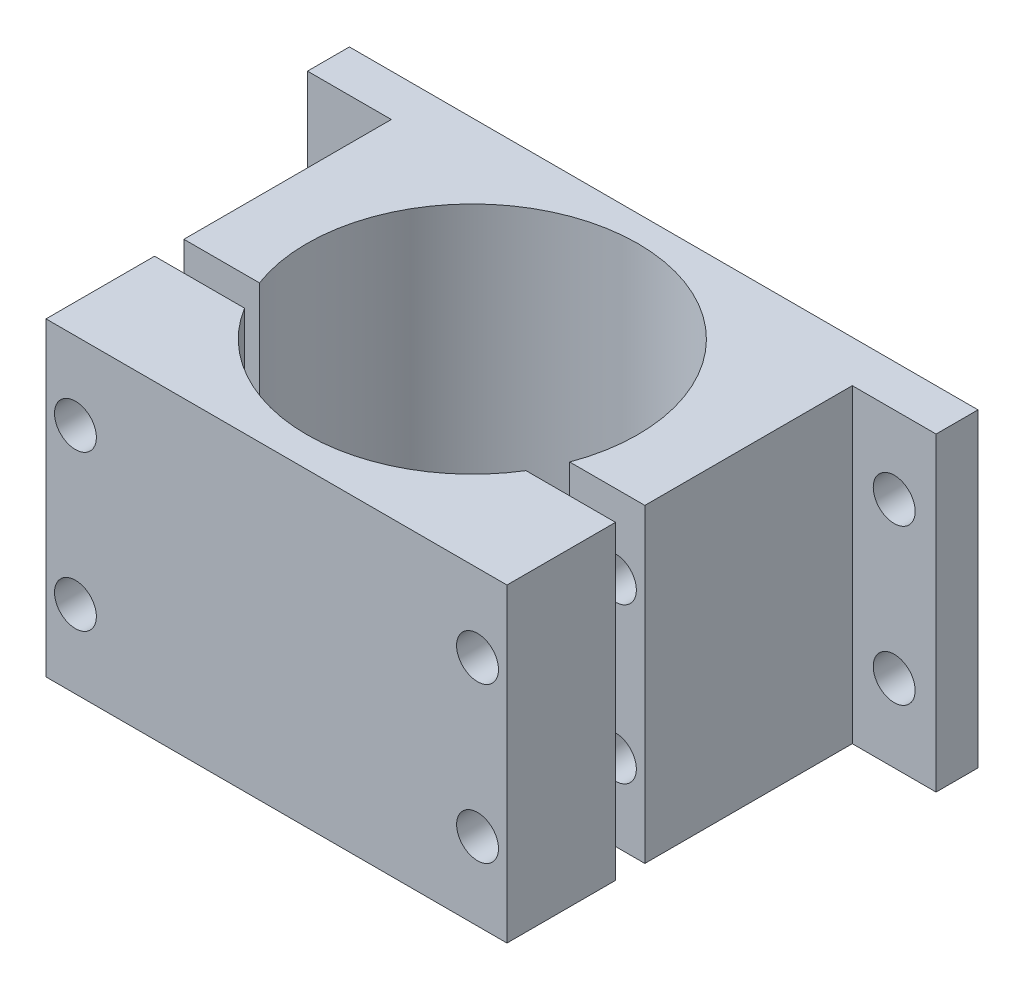
from build123d import *

# Parameters (mm, degrees)
SKETCH1_W              = 75
SKETCH1_H              = 37
BOSS_EXTRUDE1_DEPTH    = 5
SKETCH19_W             = 55
SKETCH19_H             = 37
BOSS_EXTRUDE5_DEPTH    = 41.2
SKETCH20_R             = 19.75
CUT_EXTRUDE7_DEPTH     = 71.069180101
SKETCH22_R             = 2.498129319
CUT_EXTRUDE8_DEPTH     = 25
SPLIT1_SURFACE_1_BACK  = 96.543
SPLIT1_SURFACE_1_DEPTH = 193.086
SPLIT1_SURFACE_2_BACK  = 96.543
SPLIT1_SURFACE_2_DEPTH = 193.086
SKETCH23_R             = 2.5
CUT_EXTRUDE9_DEPTH     = 59.702129433
SKETCH24_W             = 55
SKETCH24_H             = 3.5
CUT_EXTRUDE10_DEPTH    = 71.069180101


with BuildPart() as part:
    # Sketch1 → Boss-Extrude1 (new body)
    with BuildSketch(Plane.XY):
        Rectangle(SKETCH1_W, SKETCH1_H)
    extrude(amount=BOSS_EXTRUDE1_DEPTH)

    # Sketch19 → Boss-Extrude5 (add)
    with BuildSketch(Plane.XY.offset(5)):
        Rectangle(SKETCH19_W, SKETCH19_H)
    extrude(amount=BOSS_EXTRUDE5_DEPTH)

    # Sketch20 → Cut-Extrude7 (cut, through all)
    with BuildSketch(Plane(origin=(0, 18.5, 0), x_dir=(1, 0, 0), z_dir=(0, 1, 0))):
        with Locations((0.023568345, -22.855008575)):
            Circle(SKETCH20_R)
    extrude(amount=-CUT_EXTRUDE7_DEPTH, mode=Mode.SUBTRACT)

    # Sketch22 → Cut-Extrude8 (cut)
    with BuildSketch(Plane.XY.offset(46.2)):
        with Locations((-23.988215828, 9.25)):
            Circle(SKETCH22_R)
        with Locations((-23.988215828, -9.25)):
            Circle(SKETCH22_R)
        with Locations((23.988215828, -9.25)):
            Circle(SKETCH22_R)
        with Locations((23.988215828, 9.25)):
            Circle(SKETCH22_R)
    extrude(amount=-CUT_EXTRUDE8_DEPTH, mode=Mode.SUBTRACT)


with BuildPart() as body_2:
    # Split1: the piece behind the surface
    add(part.part)
    # Split1 surface: a surface, the sketch's curves swept straight by 193.086 mm
    with BuildLine(Plane(origin=(0, 18.5, 0), x_dir=(1, 0, 0), z_dir=(0, 1, 0)).offset(-SPLIT1_SURFACE_1_BACK), mode=Mode.PRIVATE) as split1_surface_1_path:
        Line((-27.5, -33.248134685), (27.5, -33.248134685))
    split1_surface_1 = Shell.extrude(split1_surface_1_path.wire(), (0 * SPLIT1_SURFACE_1_DEPTH, 1 * SPLIT1_SURFACE_1_DEPTH, 0 * SPLIT1_SURFACE_1_DEPTH))
    split(bisect_by=split1_surface_1, keep=Keep.BOTTOM)


with BuildPart() as part_1:
    add(part.part)

    # Split1: split by a surface, the side it looks to stays
    # Split1 surface: a surface, the sketch's curves swept straight by 193.086 mm
    with BuildLine(Plane(origin=(0, 18.5, 0), x_dir=(1, 0, 0), z_dir=(0, 1, 0)).offset(-SPLIT1_SURFACE_2_BACK), mode=Mode.PRIVATE) as split1_surface_2_path:
        Line((-27.5, -33.248134685), (27.5, -33.248134685))
    split1_surface_2 = Shell.extrude(split1_surface_2_path.wire(), (0 * SPLIT1_SURFACE_2_DEPTH, 1 * SPLIT1_SURFACE_2_DEPTH, 0 * SPLIT1_SURFACE_2_DEPTH))
    split(bisect_by=split1_surface_2, keep=Keep.TOP)

    # Sketch23 → Cut-Extrude9 (cut, through all)
    with BuildSketch(Plane.XY.offset(5)):
        with Locations((32.5, -9.25)):
            Circle(SKETCH23_R)
        with Locations((32.5, 9.25)):
            Circle(SKETCH23_R)
        with Locations((-32.5, -9.25)):
            Circle(SKETCH23_R)
        with Locations((-32.5, 9.25)):
            Circle(SKETCH23_R)
    extrude(amount=-CUT_EXTRUDE9_DEPTH, mode=Mode.SUBTRACT)

    # Sketch24 → Cut-Extrude10 (cut, through all)
    with BuildSketch(Plane(origin=(0, 18.5, 0), x_dir=(1, 0, 0), z_dir=(0, 1, 0))):
        with Locations((0, -31.498134685)):
            Rectangle(SKETCH24_W, SKETCH24_H)
    extrude(amount=-CUT_EXTRUDE10_DEPTH, mode=Mode.SUBTRACT)


solid = Compound([body_2.part, part_1.part])
